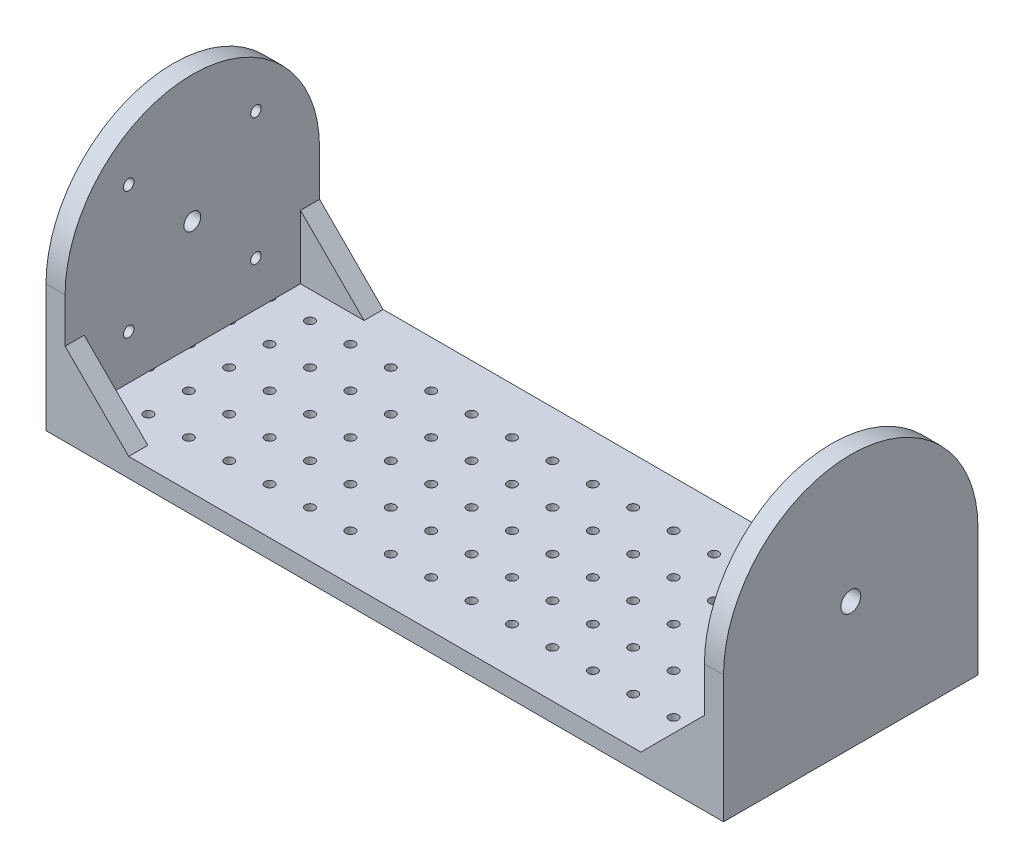
from build123d import *

# Parameters (mm, degrees)
SKETCH1_R           = 10
BOSS_EXTRUDE1_DEPTH = 6
SKETCH2_R           = 1.65
CUT_EXTRUDE1_DEPTH  = 16.362291496
SKETCH5_R           = 10
BOSS_EXTRUDE2_DEPTH = 6
SKETCH6_R           = 3.15
BOSS_EXTRUDE3_DEPTH = 6
BOSS_EXTRUDE4_REACH = 216.59
SKETCH7_W           = 80
SKETCH7_H           = 6
LOFT1_START         = 34
LOFT1_DEPTH         = 6
LOFT2_START         = -40
LOFT2_DEPTH         = 6
SKETCH10_R          = 1.45
CUT_EXTRUDE3_DEPTH  = 230.008733458
CUT_EXTRUDE4_REACH  = 222.384
SKETCH13_R          = 2.65
SKETCH13_R_2        = 1.65


# Read off the part's stored shape, not the designer's step: Loft1, Loft2
with BuildPart() as part:
    # Sketch1 → Boss-Extrude1 (new body)
    with BuildSketch(Plane(origin=(0, 0, 0), x_dir=(0, 0, -1), z_dir=(1, 0, 0))):
        Circle(SKETCH1_R)
    extrude(amount=BOSS_EXTRUDE1_DEPTH)

    # Sketch2 → Cut-Extrude1 (cut, through all)
    with BuildSketch(Plane(origin=(6, 0, 0), x_dir=(0, 0, -1), z_dir=(1, 0, 0))):
        Circle(SKETCH2_R)
    extrude(amount=-CUT_EXTRUDE1_DEPTH, mode=Mode.SUBTRACT)

    # Sketch5 → Boss-Extrude2 (add)
    with BuildSketch(Plane.ZY):
        with BuildLine():
            Line((-40, 0), (-40, -40))
            Line((-40, -40), (40, -40))
            Line((40, -40), (40, 0))
            ThreePointArc((40, 0), (0, 40), (-40, 0))
        make_face()
        Circle(SKETCH5_R, mode=Mode.SUBTRACT)
    extrude(amount=-BOSS_EXTRUDE2_DEPTH)


with BuildPart() as body_2:
    # Sketch6 → Boss-Extrude3 (new body)
    with BuildSketch(Plane(origin=(213, 0, 0), x_dir=(0, 0, -1), z_dir=(1, 0, 0))):
        with BuildLine():
            Line((-40, 0), (-40, -40))
            Line((-40, -40), (40, -40))
            Line((40, -40), (40, 0))
            ThreePointArc((40, 0), (0, 40), (-40, 0))
        make_face()
        Circle(SKETCH6_R, mode=Mode.SUBTRACT)
    extrude(amount=-BOSS_EXTRUDE3_DEPTH)

    # Sketch7 → Boss-Extrude4 (add, up to next)
    with BuildSketch(Plane(origin=(6, 0, 0), x_dir=(0, 0, -1), z_dir=(1, 0, 0)), mode=Mode.PRIVATE) as boss_extrude4_sk1:
        with Locations((0, -37)):
            Rectangle(SKETCH7_W, SKETCH7_H)
    boss_extrude4_tool1 = extrude(boss_extrude4_sk1.sketch, amount=BOSS_EXTRUDE4_REACH, mode=Mode.PRIVATE) - body_2.part

    add(part.part)  # Boss-Extrude4 merges part
    add(boss_extrude4_tool1.solids().sort_by_distance((6, -37, 0))[0])

    # Loft1 outline → Loft1 (add)
    with BuildSketch(Plane.XY.offset(LOFT1_START)):
        Polygon((6, -34), (26, -34), (6, -14), align=None)
    loft1 = extrude(amount=LOFT1_DEPTH)

    # Loft2 outline → Loft2 (add)
    with BuildSketch(Plane.XY.offset(LOFT2_START)):
        Polygon((6, -34), (26, -34), (6, -14), align=None)
    loft2 = extrude(amount=LOFT2_DEPTH)

    # Mirror1: Loft1, Loft2 across plane
    add(loft1.mirror(Plane(origin=(106.5, 0, 0), x_dir=(0, 0, 1), z_dir=(1, 0, 0))))
    add(loft2.mirror(Plane(origin=(106.5, 0, 0), x_dir=(0, 0, 1), z_dir=(1, 0, 0))))

    # Sketch10 → Cut-Extrude3 (cut, through all)
    with BuildSketch(Plane(origin=(0, -34, 0), x_dir=(1, 0, 0), z_dir=(0, 1, 0))):
        with Locations(Location((106.5, 0, 0), (0, 0, 270))):
            Circle(SKETCH10_R)
        with Locations(Location((93.8, 0, 0), (0, 0, 270))):
            Circle(SKETCH10_R)
        with Locations(Location((81.1, 0, 0), (0, 0, 270))):
            Circle(SKETCH10_R)
        with Locations(Location((68.4, 0, 0), (0, 0, 270))):
            Circle(SKETCH10_R)
        with Locations(Location((55.7, 0, 0), (0, 0, 270))):
            Circle(SKETCH10_R)
        with Locations(Location((43, 0, 0), (0, 0, 270))):
            Circle(SKETCH10_R)
        with Locations(Location((30.3, 0, 0), (0, 0, 270))):
            Circle(SKETCH10_R)
        with Locations(Location((17.6, 0, 0), (0, 0, 270))):
            Circle(SKETCH10_R)
        with Locations(Location((4.9, 0, 0), (0, 0, 270))):
            Circle(SKETCH10_R)
        with Locations(Location((119.2, 0, 0), (0, 0, 270))):
            Circle(SKETCH10_R)
        with Locations(Location((131.9, 0, 0), (0, 0, 270))):
            Circle(SKETCH10_R)
        with Locations(Location((144.6, 0, 0), (0, 0, 270))):
            Circle(SKETCH10_R)
        with Locations(Location((157.3, 0, 0), (0, 0, 270))):
            Circle(SKETCH10_R)
        with Locations(Location((170, 0, 0), (0, 0, 270))):
            Circle(SKETCH10_R)
        with Locations(Location((182.7, 0, 0), (0, 0, 270))):
            Circle(SKETCH10_R)
        with Locations(Location((195.4, 0, 0), (0, 0, 270))):
            Circle(SKETCH10_R)
        with Locations(Location((208.1, 0, 0), (0, 0, 270))):
            Circle(SKETCH10_R)
        with Locations(Location((106.5, 12.7, 0), (0, 0, 270))):
            Circle(SKETCH10_R)
        with Locations(Location((93.8, 12.7, 0), (0, 0, 270))):
            Circle(SKETCH10_R)
        with Locations(Location((81.1, 12.7, 0), (0, 0, 270))):
            Circle(SKETCH10_R)
        with Locations(Location((68.4, 12.7, 0), (0, 0, 270))):
            Circle(SKETCH10_R)
        with Locations(Location((55.7, 12.7, 0), (0, 0, 270))):
            Circle(SKETCH10_R)
        with Locations(Location((43, 12.7, 0), (0, 0, 270))):
            Circle(SKETCH10_R)
        with Locations(Location((30.3, 12.7, 0), (0, 0, 270))):
            Circle(SKETCH10_R)
        with Locations(Location((17.6, 12.7, 0), (0, 0, 270))):
            Circle(SKETCH10_R)
        with Locations(Location((4.9, 12.7, 0), (0, 0, 270))):
            Circle(SKETCH10_R)
        with Locations(Location((119.2, 12.7, 0), (0, 0, 270))):
            Circle(SKETCH10_R)
        with Locations(Location((131.9, 12.7, 0), (0, 0, 270))):
            Circle(SKETCH10_R)
        with Locations(Location((144.6, 12.7, 0), (0, 0, 270))):
            Circle(SKETCH10_R)
        with Locations(Location((157.3, 12.7, 0), (0, 0, 270))):
            Circle(SKETCH10_R)
        with Locations(Location((170, 12.7, 0), (0, 0, 270))):
            Circle(SKETCH10_R)
        with Locations(Location((182.7, 12.7, 0), (0, 0, 270))):
            Circle(SKETCH10_R)
        with Locations(Location((195.4, 12.7, 0), (0, 0, 270))):
            Circle(SKETCH10_R)
        with Locations(Location((208.1, 12.7, 0), (0, 0, 270))):
            Circle(SKETCH10_R)
        with Locations(Location((106.5, 25.4, 0), (0, 0, 270))):
            Circle(SKETCH10_R)
        with Locations(Location((93.8, 25.4, 0), (0, 0, 270))):
            Circle(SKETCH10_R)
        with Locations(Location((81.1, 25.4, 0), (0, 0, 270))):
            Circle(SKETCH10_R)
        with Locations(Location((68.4, 25.4, 0), (0, 0, 270))):
            Circle(SKETCH10_R)
        with Locations(Location((55.7, 25.4, 0), (0, 0, 270))):
            Circle(SKETCH10_R)
        with Locations(Location((43, 25.4, 0), (0, 0, 270))):
            Circle(SKETCH10_R)
        with Locations(Location((30.3, 25.4, 0), (0, 0, 270))):
            Circle(SKETCH10_R)
        with Locations(Location((17.6, 25.4, 0), (0, 0, 270))):
            Circle(SKETCH10_R)
        with Locations(Location((4.9, 25.4, 0), (0, 0, 270))):
            Circle(SKETCH10_R)
        with Locations(Location((119.2, 25.4, 0), (0, 0, 270))):
            Circle(SKETCH10_R)
        with Locations(Location((131.9, 25.4, 0), (0, 0, 270))):
            Circle(SKETCH10_R)
        with Locations(Location((144.6, 25.4, 0), (0, 0, 270))):
            Circle(SKETCH10_R)
        with Locations(Location((157.3, 25.4, 0), (0, 0, 270))):
            Circle(SKETCH10_R)
        with Locations(Location((170, 25.4, 0), (0, 0, 270))):
            Circle(SKETCH10_R)
        with Locations(Location((182.7, 25.4, 0), (0, 0, 270))):
            Circle(SKETCH10_R)
        with Locations(Location((195.4, 25.4, 0), (0, 0, 270))):
            Circle(SKETCH10_R)
        with Locations(Location((208.1, 25.4, 0), (0, 0, 270))):
            Circle(SKETCH10_R)
        with Locations(Location((106.5, -12.7, 0), (0, 0, 270))):
            Circle(SKETCH10_R)
        with Locations(Location((93.8, -12.7, 0), (0, 0, 270))):
            Circle(SKETCH10_R)
        with Locations(Location((81.1, -12.7, 0), (0, 0, 270))):
            Circle(SKETCH10_R)
        with Locations(Location((68.4, -12.7, 0), (0, 0, 270))):
            Circle(SKETCH10_R)
        with Locations(Location((55.7, -12.7, 0), (0, 0, 270))):
            Circle(SKETCH10_R)
        with Locations(Location((43, -12.7, 0), (0, 0, 270))):
            Circle(SKETCH10_R)
        with Locations(Location((30.3, -12.7, 0), (0, 0, 270))):
            Circle(SKETCH10_R)
        with Locations(Location((17.6, -12.7, 0), (0, 0, 270))):
            Circle(SKETCH10_R)
        with Locations(Location((4.9, -12.7, 0), (0, 0, 270))):
            Circle(SKETCH10_R)
        with Locations(Location((119.2, -12.7, 0), (0, 0, 270))):
            Circle(SKETCH10_R)
        with Locations(Location((131.9, -12.7, 0), (0, 0, 270))):
            Circle(SKETCH10_R)
        with Locations(Location((144.6, -12.7, 0), (0, 0, 270))):
            Circle(SKETCH10_R)
        with Locations(Location((157.3, -12.7, 0), (0, 0, 270))):
            Circle(SKETCH10_R)
        with Locations(Location((170, -12.7, 0), (0, 0, 270))):
            Circle(SKETCH10_R)
        with Locations(Location((182.7, -12.7, 0), (0, 0, 270))):
            Circle(SKETCH10_R)
        with Locations(Location((195.4, -12.7, 0), (0, 0, 270))):
            Circle(SKETCH10_R)
        with Locations(Location((208.1, -12.7, 0), (0, 0, 270))):
            Circle(SKETCH10_R)
        with Locations(Location((106.5, -25.4, 0), (0, 0, 270))):
            Circle(SKETCH10_R)
        with Locations(Location((93.8, -25.4, 0), (0, 0, 270))):
            Circle(SKETCH10_R)
        with Locations(Location((81.1, -25.4, 0), (0, 0, 270))):
            Circle(SKETCH10_R)
        with Locations(Location((68.4, -25.4, 0), (0, 0, 270))):
            Circle(SKETCH10_R)
        with Locations(Location((55.7, -25.4, 0), (0, 0, 270))):
            Circle(SKETCH10_R)
        with Locations(Location((43, -25.4, 0), (0, 0, 270))):
            Circle(SKETCH10_R)
        with Locations(Location((30.3, -25.4, 0), (0, 0, 270))):
            Circle(SKETCH10_R)
        with Locations(Location((17.6, -25.4, 0), (0, 0, 270))):
            Circle(SKETCH10_R)
        with Locations(Location((4.9, -25.4, 0), (0, 0, 270))):
            Circle(SKETCH10_R)
        with Locations(Location((119.2, -25.4, 0), (0, 0, 270))):
            Circle(SKETCH10_R)
        with Locations(Location((131.9, -25.4, 0), (0, 0, 270))):
            Circle(SKETCH10_R)
        with Locations(Location((144.6, -25.4, 0), (0, 0, 270))):
            Circle(SKETCH10_R)
        with Locations(Location((157.3, -25.4, 0), (0, 0, 270))):
            Circle(SKETCH10_R)
        with Locations(Location((170, -25.4, 0), (0, 0, 270))):
            Circle(SKETCH10_R)
        with Locations(Location((182.7, -25.4, 0), (0, 0, 270))):
            Circle(SKETCH10_R)
        with Locations(Location((195.4, -25.4, 0), (0, 0, 270))):
            Circle(SKETCH10_R)
        with Locations(Location((208.1, -25.4, 0), (0, 0, 270))):
            Circle(SKETCH10_R)
    extrude(amount=-CUT_EXTRUDE3_DEPTH, mode=Mode.SUBTRACT)

    # Sketch13 → Cut-Extrude4 (cut, up to next)
    with BuildSketch(Plane.ZY, mode=Mode.PRIVATE) as cut_extrude4_sk1:
        Circle(SKETCH13_R)
    cut_extrude4_tool1 = extrude(cut_extrude4_sk1.sketch, amount=-CUT_EXTRUDE4_REACH, mode=Mode.PRIVATE) & body_2.part
    # Sketch13 → Cut-Extrude4 (cut, up to next)
    with BuildSketch(Plane.ZY, mode=Mode.PRIVATE) as cut_extrude4_sk2:
        with Locations((-20, 20)):
            Circle(SKETCH13_R_2)
    cut_extrude4_tool2 = extrude(cut_extrude4_sk2.sketch, amount=-CUT_EXTRUDE4_REACH, mode=Mode.PRIVATE) & body_2.part
    # Sketch13 → Cut-Extrude4 (cut, up to next)
    with BuildSketch(Plane.ZY, mode=Mode.PRIVATE) as cut_extrude4_sk3:
        with Locations((-20, -20)):
            Circle(SKETCH13_R_2)
    cut_extrude4_tool3 = extrude(cut_extrude4_sk3.sketch, amount=-CUT_EXTRUDE4_REACH, mode=Mode.PRIVATE) & body_2.part
    # Sketch13 → Cut-Extrude4 (cut, up to next)
    with BuildSketch(Plane.ZY, mode=Mode.PRIVATE) as cut_extrude4_sk4:
        with Locations((20, -20)):
            Circle(SKETCH13_R_2)
    cut_extrude4_tool4 = extrude(cut_extrude4_sk4.sketch, amount=-CUT_EXTRUDE4_REACH, mode=Mode.PRIVATE) & body_2.part
    # Sketch13 → Cut-Extrude4 (cut, up to next)
    with BuildSketch(Plane.ZY, mode=Mode.PRIVATE) as cut_extrude4_sk5:
        with Locations((20, 20)):
            Circle(SKETCH13_R_2)
    cut_extrude4_tool5 = extrude(cut_extrude4_sk5.sketch, amount=-CUT_EXTRUDE4_REACH, mode=Mode.PRIVATE) & body_2.part
    add(cut_extrude4_tool1.solids().sort_by_distance((0, 0, 0))[0], mode=Mode.SUBTRACT)
    add(cut_extrude4_tool2.solids().sort_by_distance((0, 20, -20))[0], mode=Mode.SUBTRACT)
    add(cut_extrude4_tool3.solids().sort_by_distance((0, -20, -20))[0], mode=Mode.SUBTRACT)
    add(cut_extrude4_tool4.solids().sort_by_distance((0, -20, 20))[0], mode=Mode.SUBTRACT)
    add(cut_extrude4_tool5.solids().sort_by_distance((0, 20, 20))[0], mode=Mode.SUBTRACT)


solid = body_2.part
